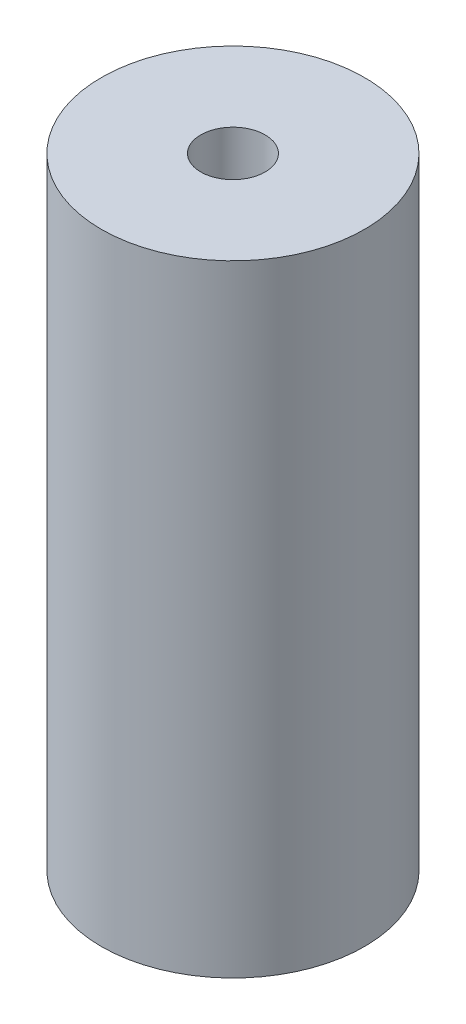
from build123d import *

# Parameters (mm, degrees)
SKETCH1_R           = 11.65
BOSS_EXTRUDE1_DEPTH = 55
SKETCH2_R           = 2.85
CUT_EXTRUDE1_DEPTH  = 110


with BuildPart() as part:
    # Sketch1 → Boss-Extrude1 (new body)
    with BuildSketch(Plane(origin=(0, 0, 0), x_dir=(1, 0, 0), z_dir=(0, 1, 0))):
        Circle(SKETCH1_R)
    extrude(amount=BOSS_EXTRUDE1_DEPTH)

    # Sketch2 → Cut-Extrude1 (cut)
    with BuildSketch(Plane(origin=(0, 55, 0), x_dir=(1, 0, 0), z_dir=(0, 1, 0))):
        Circle(SKETCH2_R)
    extrude(amount=-CUT_EXTRUDE1_DEPTH, mode=Mode.SUBTRACT)


solid = part.part
